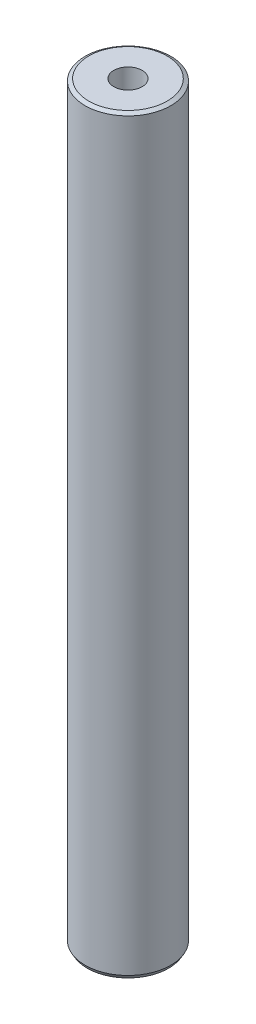
from build123d import *
from OCP.BRepFilletAPI import BRepFilletAPI_MakeChamfer

# Parameters (mm, degrees)
SKETCH1_R           = 32.5
BOSS_EXTRUDE1_DEPTH = 569.131867104
SKETCH2_R           = 10.762776828
CUT_EXTRUDE1_DEPTH  = 571.984747741
CHAMFER1_SIZE       = 1.611235554
CHAMFER1_SIZE2      = 2.790741842


with BuildPart() as part:
    # Sketch1 → Boss-Extrude1 (new body)
    with BuildSketch(Plane(origin=(0, 0, 0), x_dir=(1, 0, 0), z_dir=(0, 1, 0))):
        Circle(SKETCH1_R)
    extrude(amount=BOSS_EXTRUDE1_DEPTH)

    # Sketch2 → Cut-Extrude1 (cut, through all)
    with BuildSketch(Plane(origin=(0, 0, 0), x_dir=(1, 0, 0), z_dir=(0, 1, 0))):
        Circle(SKETCH2_R)
    extrude(amount=CUT_EXTRUDE1_DEPTH, mode=Mode.SUBTRACT)

    # Chamfer1: one chamfer whose edges measure the first distance from different faces: ONE call of the kernel's chamfer builder (chamfer() names one face for all edges)
    chamfer1_edges_1 = [part.edges().sort_by_distance(p)[0] for p in [
        (-32.5, 569.131867104, 0),
    ]]
    chamfer1_side_1 = [part.faces().sort_by_distance(p)[0] for p in [
        (-32.5, 284.565933552, 0),
    ]]
    chamfer1_edges_2 = [part.edges().sort_by_distance(p)[0] for p in [
        (-32.5, 0, 0),
    ]]
    chamfer1_side_2 = [part.faces().sort_by_distance(p)[0] for p in [
        (-31.580761184, 0, 0),
    ]]
    chamfer1 = BRepFilletAPI_MakeChamfer(part.part.solid().wrapped)
    for e in chamfer1_edges_1:
        chamfer1.Add(CHAMFER1_SIZE, CHAMFER1_SIZE2, e.wrapped, chamfer1_side_1[0].wrapped)  # the first distance lies on this face
    for e in chamfer1_edges_2:
        chamfer1.Add(CHAMFER1_SIZE, CHAMFER1_SIZE2, e.wrapped, chamfer1_side_2[0].wrapped)  # the first distance lies on this face
    add(Compound.cast(chamfer1.Shape()), mode=Mode.REPLACE)


solid = part.part
